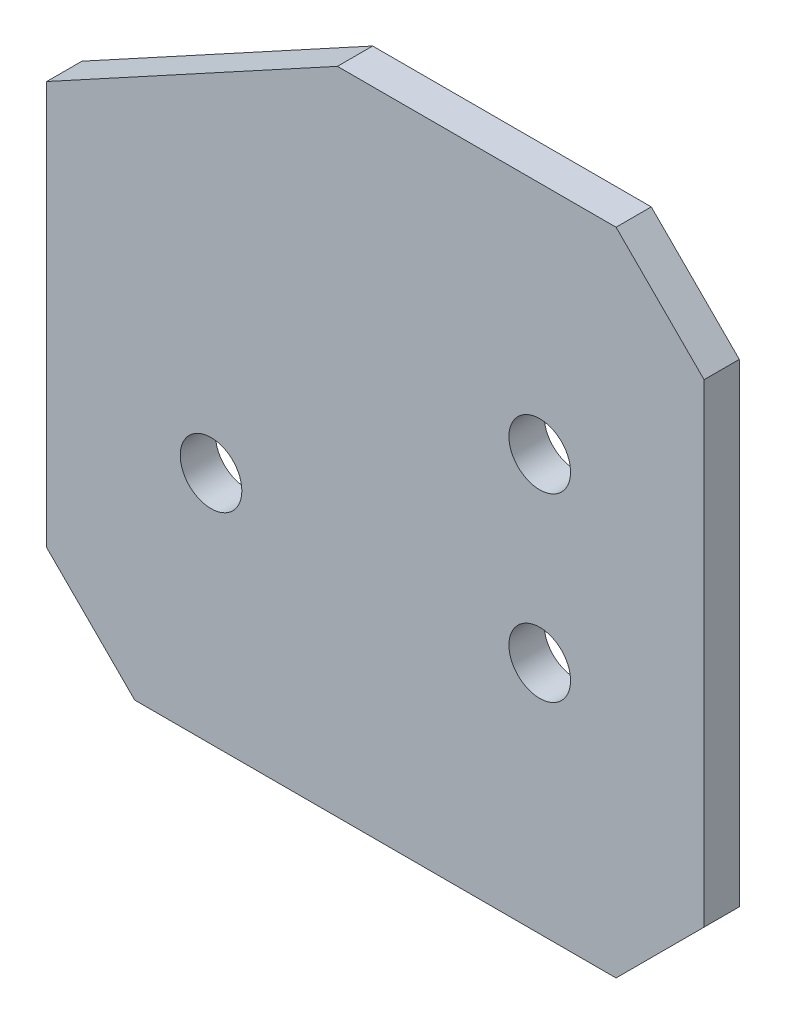
from build123d import *

# Parameters (mm, degrees)
SKETCH_1_W             = 112
SKETCH_1_H             = 110.77381068
SKETCH_1_R             = 5.25
SM_BASE_FLANGE_1_DEPTH = 6
CHAMFER_1_SIZE         = 15
CUT_EXTRUDE_1_DEPTH    = 10


# Sheet-metal steps are written as plain solids
with BuildPart() as part:
    # Sketch 1 → Базовая кромка1 (new body)
    with BuildSketch(Plane.XY):
        with Locations((0, 58.38690534)):
            Rectangle(SKETCH_1_W, SKETCH_1_H)
        with Locations((-28, 43)):
            Circle(SKETCH_1_R, mode=Mode.SUBTRACT)
        with Locations(Location((28, 73.77381068, 0), (0, 0, 180))):
            Circle(SKETCH_1_R, mode=Mode.SUBTRACT)
        with Locations(Location((28, 43, 0), (0, 0, 180))):
            Circle(SKETCH_1_R, mode=Mode.SUBTRACT)
    extrude(amount=-SM_BASE_FLANGE_1_DEPTH)

    # Фаска1
    chamfer_1_edges = [part.edges().sort_by_distance(p)[0] for p in [
        (56, 3, -3),
        (-56, 3, -3),
        (-56, 113.77381068, -3),
        (56, 113.77381068, -3),
    ]]
    chamfer(chamfer_1_edges, length=CHAMFER_1_SIZE)

    # Sketch 2 → Вырез-Вытянуть1 (cut)
    with BuildSketch(Plane.XY):
        Polygon((-56, 113.77381068), (-56, 86.768448621), (-6.468509112, 113.77381068), align=None)
    extrude(amount=-CUT_EXTRUDE_1_DEPTH, mode=Mode.SUBTRACT)


solid = part.part
